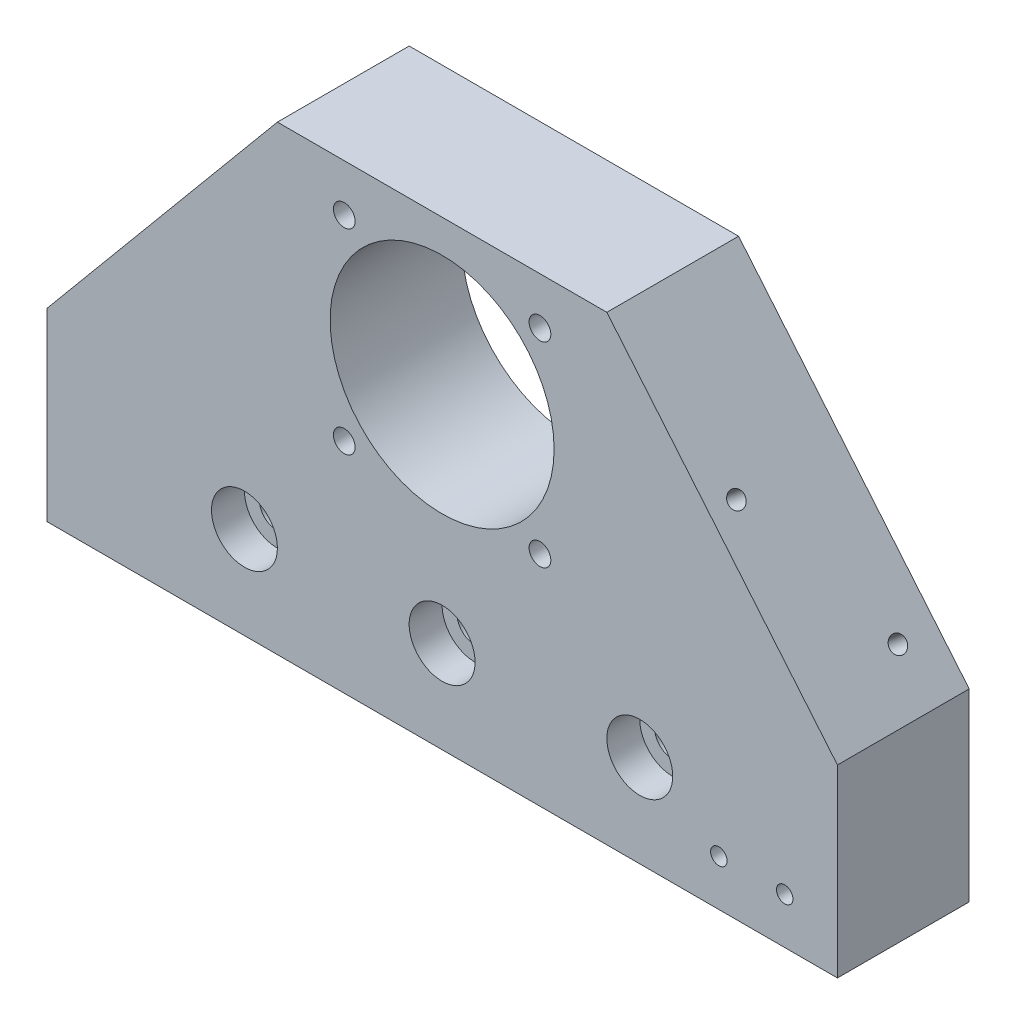
from build123d import *

# Parameters (mm, degrees)
BOSS_EXTRUDE1_DEPTH            = 20
CBORE_FOR_M5_SHCS1_D           = 5.5
CBORE_FOR_M5_SHCS1_CBORE_D     = 10
CBORE_FOR_M5_SHCS1_CBORE_DEPTH = 5
SKETCH4_R                      = 17
CUT_EXTRUDE1_DEPTH             = 95.339811321
M4_TAPPED_HOLE1_D              = 3.3
M4_TAPPED_HOLE2_D              = 3.3
M4_TAPPED_HOLE2_DEPTH          = 15
M4_TAPPED_HOLE2_TIP            = 0.991420021
M3_TAPPED_HOLE1_D              = 2.5
M3_TAPPED_HOLE1_DEPTH          = 7.5
M3_TAPPED_HOLE1_TIP            = 0.751075774
M3_TAPPED_HOLE2_D              = 2.5
M3_TAPPED_HOLE2_DEPTH          = 11.5
M3_TAPPED_HOLE2_TIP            = 0.751075774


with BuildPart() as part:
    # Sketch1 → Boss-Extrude1 (new body)
    with BuildSketch(Plane.XY):
        Polygon((60, 0), (-60, 0), (-60, 28), (-25, 70), (25, 70), (60, 28), align=None)
    extrude(amount=BOSS_EXTRUDE1_DEPTH)

    # CBORE for M5 SHCS1 (through all)
    with Locations(Plane(origin=(-30, 14, 20), x_dir=(1, 0, 0), z_dir=(0, 0, 1))):
        with Locations((0, 0), (30, 0), (60, 0)):
            CounterBoreHole(CBORE_FOR_M5_SHCS1_D / 2, CBORE_FOR_M5_SHCS1_CBORE_D / 2, CBORE_FOR_M5_SHCS1_CBORE_DEPTH)

    # Sketch4 → Cut-Extrude1 (cut, through all)
    with BuildSketch(Plane.XY.offset(20)):
        with Locations((0, 48)):
            Circle(SKETCH4_R)
    extrude(amount=-CUT_EXTRUDE1_DEPTH, mode=Mode.SUBTRACT)

    # M4 Tapped Hole1 (through all)
    with Locations(Plane(origin=(-14.849242405, 62.849242405, 20), x_dir=(1, 0, 0), z_dir=(0, 0, 1))):
        with Locations((0, 0), (29.69848481, 0), (29.69848481, -29.69848481), (0, -29.69848481)):
            Hole(M4_TAPPED_HOLE1_D / 2)

    # M4 Tapped Hole2
    with Locations(Plane(origin=(0, 0, 0), x_dir=(-1, 0, 0), z_dir=(0, -1, 0))):
        with Locations((20, -10), (-20, -10)):
            Hole(M4_TAPPED_HOLE2_D / 2, depth=M4_TAPPED_HOLE2_DEPTH)
            with Locations((0, 0, -(M4_TAPPED_HOLE2_DEPTH + M4_TAPPED_HOLE2_TIP / 2))):  # 118° drill point
                Cone(0, M4_TAPPED_HOLE2_D / 2, M4_TAPPED_HOLE2_TIP, mode=Mode.SUBTRACT)

    # M3 Tapped Hole1
    with Locations(Plane(origin=(42, 7, 20), x_dir=(1, 0, 0), z_dir=(0, 0, 1))):
        with Locations((0, 0), (10, 0)):
            Hole(M3_TAPPED_HOLE1_D / 2, depth=M3_TAPPED_HOLE1_DEPTH)
            with Locations((0, 0, -(M3_TAPPED_HOLE1_DEPTH + M3_TAPPED_HOLE1_TIP / 2))):  # 118° drill point
                Cone(0, M3_TAPPED_HOLE1_D / 2, M3_TAPPED_HOLE1_TIP, mode=Mode.SUBTRACT)

    # M3 Tapped Hole2
    with Locations(Plane(origin=(49.180327869, 40.983606557, 0), x_dir=(0, 0, -1), z_dir=(0.7682212795973757, 0.6401843996644799, 0))):
        with Locations((-16, 13.299131849), (-5.7, -8.900868151)):
            Hole(M3_TAPPED_HOLE2_D / 2, depth=M3_TAPPED_HOLE2_DEPTH)
            with Locations((0, 0, -(M3_TAPPED_HOLE2_DEPTH + M3_TAPPED_HOLE2_TIP / 2))):  # 118° drill point
                Cone(0, M3_TAPPED_HOLE2_D / 2, M3_TAPPED_HOLE2_TIP, mode=Mode.SUBTRACT)


solid = part.part
